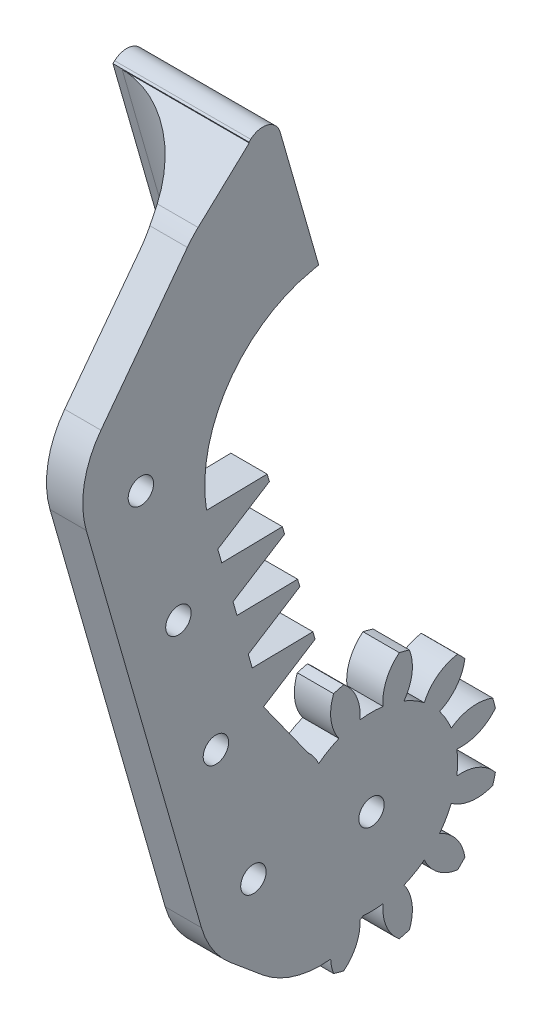
from build123d import *

# Parameters (mm, degrees)
BASPROSKE_W              = 4
BASPROSKE_H              = 14
TOOTHCUT_DEPTH           = 21.199009877
TEETHCUTS_COUNT          = 12
TEETHCUTS_ANGLE          = 330
BORSKE_R                 = 4
BORE_DEPTH               = 50.0000508
EXTRUDE_1_DEPTH          = 4
FILLET_1_R               = 10
EXTRUDE_2_DEPTH          = 15
FILLET_2_R               = 2
FILLET_3_R               = 10
EXTRUDE_START            = -4
SKETCH_6_R               = 4
SKETCH_6_R_2             = 1.4
EXTRUDE_3_DEPTH          = 4
CUT_EXTRUDE_6_DEPTH      = 15
CUT_EXTRUDE_6_DEPTH_BACK = 34
SKETCH_7_R               = 1.4
SKETCH_8_R               = 3
CUT_EXTRUDE_7_DEPTH      = 6
SKETCH_10_R              = 1.4
CUT_EXTRUDE_8_DEPTH      = 15


with BuildPart() as part:
    # BasProSke → Base-Revolve (revolve)
    with BuildSketch(Plane(origin=(0, 0, 0), x_dir=(1, 0, 0), z_dir=(0, 1, 0)), mode=Mode.PRIVATE) as base_revolve_sk:
        with Locations((2, 7)):
            Rectangle(BASPROSKE_W, BASPROSKE_H)
    revolve(base_revolve_sk.sketch.rotate(Axis((-10, 0, 0), (1, 0, 0)), 180), axis=Axis((-10, 0, 0), (1, 0, 0)))

    # TooCutSke → ToothCut (cut, through all)
    with BuildSketch(Plane(origin=(0, 0, 0), x_dir=(0, 0, -1), z_dir=(1, 0, 0))):
        with BuildLine():
            ThreePointArc((1.286803432, 9.41143655), (0, 9.499), (-1.286803432, 9.41143655))
            ThreePointArc((-1.286803432, 9.41143655), (-1.63841703, 11.778122922), (-3.088844097, 13.681041163))
            ThreePointArc((-3.088844097, 13.681041163), (0, 14.0254), (3.088844097, 13.681041163))
            ThreePointArc((3.088844097, 13.681041163), (1.63841703, 11.778122922), (1.286803432, 9.41143655))
        make_face()
    toothcut = extrude(amount=TOOTHCUT_DEPTH, mode=Mode.SUBTRACT)

    # TeethCuts: ToothCut ×12 about axis
    teethcuts_axis = Axis((-10, 0, 0), (1, 0, 0))
    for i in range(1, TEETHCUTS_COUNT):
        add(toothcut.rotate(teethcuts_axis, i * TEETHCUTS_ANGLE / (TEETHCUTS_COUNT - 1)), mode=Mode.SUBTRACT)

    # BorSke → Bore (cut, symmetric)
    with BuildSketch(Plane(origin=(0, 0, 0), x_dir=(0, 0, -1), z_dir=(1, 0, 0))):
        with Locations(Location((0, 0, 0), (0, 0, 180))):
            Circle(BORSKE_R)
    extrude(amount=BORE_DEPTH, both=True, mode=Mode.SUBTRACT)

    # 草图3 → 凸台-拉伸1 (add)
    with BuildSketch(Plane(origin=(4, 0, 0), x_dir=(0, 0, -1), z_dir=(1, 0, 0))):
        with BuildLine():
            Line((-0.932792576, -9.484020621), (-7.220100828, -13.585142245))
            Line((-7.220100828, -13.585142245), (-17.903981346, -4.642128436))
            Line((-17.903981346, -4.642128436), (-27.107817182, 27.455461598))
            Line((-27.107817182, 27.455461598), (-31.27472335, 41.987190356))
            Line((-31.27472335, 41.987190356), (-32.818773393, 47.371932777))
            Line((-32.818773393, 47.371932777), (-19.769712012, 64.746456846))
            Line((-19.769712012, 64.746456846), (-10.953080107, 72.951947941))
            Line((-10.953080107, 72.951947941), (-6.126084714, 56.118214487))
            Line((-6.126084714, 56.118214487), (-5.836675561, 55.108924829))
            ThreePointArc((-5.836675561, 55.108924829), (-15.58167252, 49.050779668), (-18.188670428, 37.876270712))
            Line((-18.188670428, 37.876270712), (-11.502054977, 37.992325671))
            Line((-11.502054977, 37.992325671), (-11.26200008, 37.155154756))
            Line((-11.26200008, 37.155154756), (-16.947814294, 33.548891109))
            Line((-16.947814294, 33.548891109), (-16.509005291, 32.018582252))
            Line((-16.509005291, 32.018582252), (-9.82238984, 32.134637212))
            Line((-9.82238984, 32.134637212), (-9.582334943, 31.297466297))
            Line((-9.582334943, 31.297466297), (-15.268149157, 27.691202649))
            Line((-15.268149157, 27.691202649), (-14.829340154, 26.160893793))
            Line((-14.829340154, 26.160893793), (-8.142724703, 26.276948752))
            Line((-8.142724703, 26.276948752), (-7.902669806, 25.439777837))
            Line((-7.902669806, 25.439777837), (-13.58848402, 21.83351419))
            Line((-13.58848402, 21.83351419), (-13.149675017, 20.303205333))
            Line((-13.149675017, 20.303205333), (-6.463059566, 20.419260292))
            Line((-6.463059566, 20.419260292), (-6.223004669, 19.582089377))
            Line((-6.223004669, 19.582089377), (-11.908818883, 15.97582573))
            Line((-11.908818883, 15.97582573), (-5.780671989, 7.422544069))
            ThreePointArc((-5.780671989, 7.422544069), (-4.284008868, -1.296630558), (-0.932792576, -9.484020621))
        make_face()
    extrude(amount=-EXTRUDE_1_DEPTH)

    # 圆角1
    # the kernel refuses this fillet: 10 mm, written as the material it takes off along each edge
    with BuildSketch(Plane(origin=(16.439550253, 47.371932777, 32.818773393), x_dir=(0, 0.7995984784044031, -0.6005349892665399), z_dir=(-1, 0, 0))) as fillet_1_piece_1:
        with BuildLine():
            CenterArc((FILLET_1_R * 0.497582010116, FILLET_1_R), FILLET_1_R, 217.091776954, 52.908223046)
            Line((-FILLET_1_R * 0.300088482439, FILLET_1_R * 0.396906487096), (-FILLET_1_R * 0.31604189229, FILLET_1_R * 0.384844616838))
            Line((-FILLET_1_R * 0.31604189229, FILLET_1_R * 0.384844616838), (-FILLET_1_R * 0.00995164020233, -FILLET_1_R * 0.02))
            Line((-FILLET_1_R * 0.00995164020233, -FILLET_1_R * 0.02), (FILLET_1_R * 0.497582010116, -FILLET_1_R * 0.02))
            Line((FILLET_1_R * 0.497582010116, -FILLET_1_R * 0.02), (FILLET_1_R * 0.497582010116, 0))
        make_face()
    extrude(amount=28.879100506, mode=Mode.SUBTRACT)
    with BuildSketch(Plane(origin=(6.219749224, 64.746456846, 19.769712012), x_dir=(0, 0.6812807658980115, -0.7320222114235461), z_dir=(-1, 0, 0))) as fillet_1_piece_2:
        with BuildLine():
            CenterArc((FILLET_1_R * 0.0887899689748, FILLET_1_R), FILLET_1_R, 259.852030904, 10.147969096)
            Line((-FILLET_1_R * 0.0874009400017, FILLET_1_R * 0.0156439853417), (-FILLET_1_R * 0.0909247581812, -FILLET_1_R * 0.00404313495151))
            Line((-FILLET_1_R * 0.0909247581812, -FILLET_1_R * 0.00404313495151), (-FILLET_1_R * 0.0017757993795, -FILLET_1_R * 0.02))
            Line((-FILLET_1_R * 0.0017757993795, -FILLET_1_R * 0.02), (FILLET_1_R * 0.0887899689748, -FILLET_1_R * 0.02))
            Line((FILLET_1_R * 0.0887899689748, -FILLET_1_R * 0.02), (FILLET_1_R * 0.0887899689748, 0))
        make_face()
    extrude(amount=8.439498449, mode=Mode.SUBTRACT)
    with BuildSketch(Plane(origin=(11.659672741, -4.642128436, 17.903981346), x_dir=(0, 0.9612616959383188, 0.2756373558169997), z_dir=(-1, 0, 0))) as fillet_1_piece_3:
        with BuildLine():
            CenterArc((FILLET_1_R * 0.306386909629, FILLET_1_R), FILLET_1_R, 235.931242449, 34.068757551)
            Line((-FILLET_1_R * 0.253800473888, FILLET_1_R * 0.171634081249), (-FILLET_1_R * 0.265004221559, FILLET_1_R * 0.155066762874))
            Line((-FILLET_1_R * 0.265004221559, FILLET_1_R * 0.155066762874), (-FILLET_1_R * 0.00612773819259, -FILLET_1_R * 0.02))
            Line((-FILLET_1_R * 0.00612773819259, -FILLET_1_R * 0.02), (FILLET_1_R * 0.306386909629, -FILLET_1_R * 0.02))
            Line((FILLET_1_R * 0.306386909629, -FILLET_1_R * 0.02), (FILLET_1_R * 0.306386909629, 0))
        make_face()
    extrude(amount=19.319345481, mode=Mode.SUBTRACT)
    with BuildSketch(Plane(origin=(19.737715423, -13.585142245, 7.220100828), x_dir=(0, 0.6418678587609061, 0.7668152658167999), z_dir=(-1, 0, 0))) as fillet_1_piece_4_section:
        with BuildLine():
            CenterArc((6.295086169, 10), FILLET_1_R, 223.606014756, 46.393985244)
            Line((-0.945908461, 3.103044385), (-1.090728354, 2.965105272))
            ThreePointArc((-1.090728354, 2.965105272), (-0.664263166, 1.493205031), (-0.191308935, -0.058317161))
            Line((-0.191308935, -0.058317161), (0, -0.2))
            Line((0, -0.2), (6.295086169, -0.2))
            Line((6.295086169, -0.2), (6.295086169, 0))
        make_face()
    fillet_1_piece_4 = extrude(amount=35.475430846, mode=Mode.PRIVATE)
    fillet_1_piece_4 = fillet_1_piece_4 - Plane(origin=(2, -11.614079795, -0.29286421), x_dir=(0, 0.587528112701377, 0.8092037548019401), z_dir=(-1, 0, 0)) * Cylinder(4.8, 97, mode=Mode.PRIVATE)
    add(fillet_1_piece_4, mode=Mode.SUBTRACT)

    # 草图4 → 凸台-拉伸2 (add)
    with BuildSketch(Plane(origin=(4, 0, 0), x_dir=(0, 0, -1), z_dir=(1, 0, 0))):
        Polygon((-13.512013594, 70.700072728), (-8.828756529, 54.367614394), (-5.828756529, 55.138253385), (-10.945161074, 72.981276497), align=None)
    extrude(amount=-EXTRUDE_2_DEPTH)

    # 圆角2
    fillet_2_edges = [part.edges().sort_by_distance(p)[0] for p in [
        (-3.5, 72.981276497, 10.945161074),
    ]]
    fillet(fillet_2_edges, radius=FILLET_2_R)

    # 圆角3
    fillet_3_edges = [part.edges().sort_by_distance(p)[0] for p in [
        (0, 62.482661808, 11.15570893),
    ]]
    fillet(fillet_3_edges, radius=FILLET_3_R)

    # 草图6 → 凸台-拉伸3 (add)
    with BuildSketch(Plane.ZY.offset(EXTRUDE_START)):
        Circle(SKETCH_6_R)
        Circle(SKETCH_6_R_2, mode=Mode.SUBTRACT)
    extrude(amount=EXTRUDE_3_DEPTH)

    # 草图7 → 切除-拉伸6 (cut, two sides: drawn at the far end of the back side and taken through both)
    with BuildSketch(Plane(origin=(0, 2.640469614, -9.20841187), x_dir=(-1, 0, 0), z_dir=(0, 0.275637355817, -0.9612616959383188)).offset(-CUT_EXTRUDE_6_DEPTH_BACK)):
        with Locations(Location((4, 62.608913997, 0), (0, 0, 90))):
            Circle(SKETCH_7_R)
    extrude(amount=CUT_EXTRUDE_6_DEPTH + CUT_EXTRUDE_6_DEPTH_BACK, mode=Mode.SUBTRACT)

    # 草图8 → 切除-拉伸7 (cut)
    with BuildSketch(Plane(origin=(0, 1.791367175, -6.247239762), x_dir=(1, 0, 0), z_dir=(0, -0.275637355817, 0.9612616959383187))):
        with Locations(Location((-4, 62.608913997, 0), (0, 0, 90))):
            Circle(SKETCH_8_R)
    extrude(amount=CUT_EXTRUDE_7_DEPTH, mode=Mode.SUBTRACT)

    # 草图10 → 切除-拉伸8 (cut)
    with BuildSketch(Plane(origin=(4, 0, 0), x_dir=(0, 0, -1), z_dir=(1, 0, 0))):
        with Locations((-25.423875567, 43.350590959)):
            Circle(SKETCH_10_R)
        with Locations((-21.28931523, 28.93166552)):
            Circle(SKETCH_10_R)
        with Locations((-17.154754893, 14.512740081)):
            Circle(SKETCH_10_R)
        with Locations((-13.020194555, 0.093814642)):
            Circle(SKETCH_10_R)
    extrude(amount=-CUT_EXTRUDE_8_DEPTH, mode=Mode.SUBTRACT)


solid = part.part
